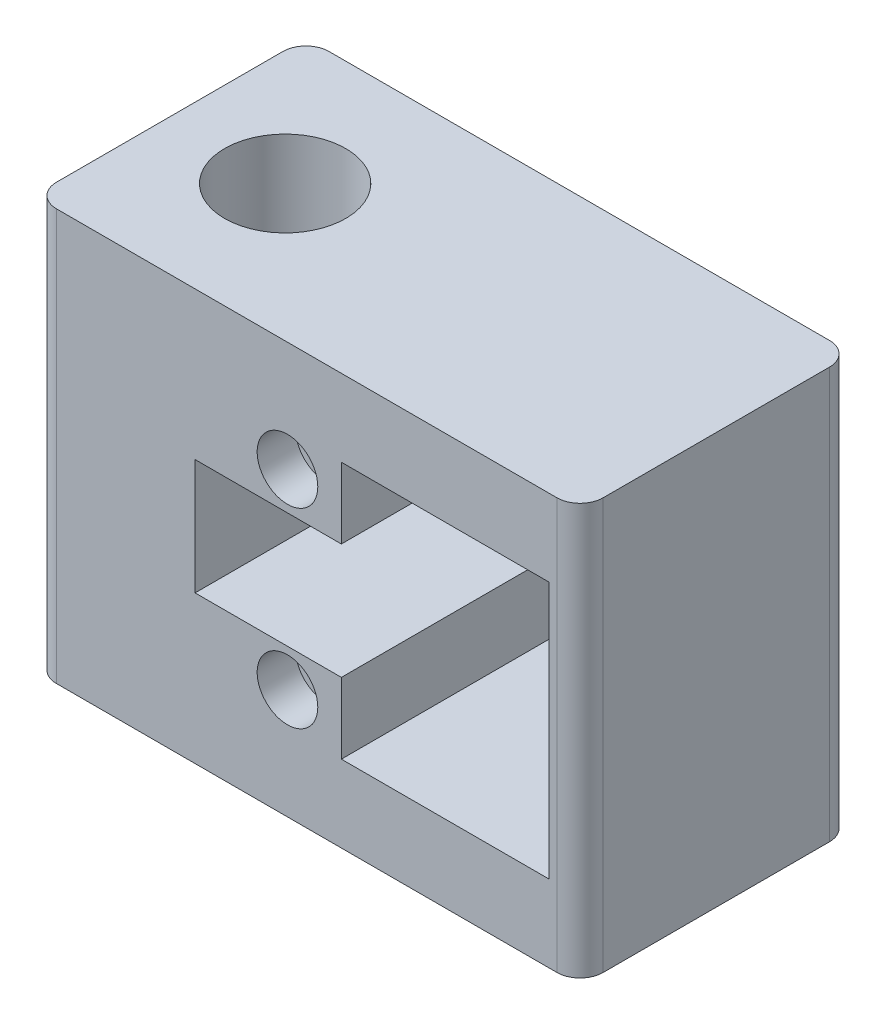
from build123d import *

# Parameters (mm, degrees)
SKETCH1_W           = 90.17
SKETCH1_H           = 67.818
BOSS_EXTRUDE1_DEPTH = 42.418
SKETCH2_W           = 90.17
SKETCH2_H           = 67.818
BOSS_EXTRUDE2_DEPTH = 2.54
SKETCH3_R           = 4.064
CUT_EXTRUDE1_DEPTH  = 95.758682177
SKETCH4_R           = 5
CUT_EXTRUDE2_DEPTH  = 6.35
SKETCH5_R           = 9.9949
CUT_EXTRUDE3_DEPTH  = 15.24
FILLET1_R           = 3.81


with BuildPart() as part:
    # Sketch1 → Boss-Extrude1 (new body)
    with BuildSketch(Plane.XY):
        with Locations((-5.715, 21.209)):
            Rectangle(SKETCH1_W, SKETCH1_H)
        Polygon((0, 30.734), (0, 42.418), (34.29, 42.418), (34.29, 0), (0, 0), (0, 11.684), (-24.13, 11.684), (-24.13, 30.734), align=None, mode=Mode.SUBTRACT)
    extrude(amount=BOSS_EXTRUDE1_DEPTH)

    # Sketch2 → Boss-Extrude2 (add)
    with BuildSketch(Plane(origin=(0, 0, 0), x_dir=(-1, 0, 0), z_dir=(0, 0, -1))):
        with Locations((5.715, 21.209)):
            Rectangle(SKETCH2_W, SKETCH2_H)
    extrude(amount=BOSS_EXTRUDE2_DEPTH)

    # Sketch3 → Cut-Extrude1 (cut, through all)
    with BuildSketch(Plane.XZ.offset(12.7)):
        with Locations((-31.75, 19.939)):
            Circle(SKETCH3_R)
    extrude(amount=-CUT_EXTRUDE1_DEPTH, mode=Mode.SUBTRACT)

    # Sketch4 → Cut-Extrude2 (cut)
    with BuildSketch(Plane.XY.offset(42.418)):
        with Locations((-8.89, 36.961)):
            Circle(SKETCH4_R)
        with Locations((-8.89, 5.461)):
            Circle(SKETCH4_R)
    extrude(amount=-CUT_EXTRUDE2_DEPTH, mode=Mode.SUBTRACT)

    # Sketch5 → Cut-Extrude3 (cut)
    with BuildSketch(Plane(origin=(0, 55.118, 0), x_dir=(1, 0, 0), z_dir=(0, 1, 0))):
        with Locations((-31.75, -19.939)):
            Circle(SKETCH5_R)
    extrude(amount=-CUT_EXTRUDE3_DEPTH, mode=Mode.SUBTRACT)

    # Fillet1
    fillet1_edges = [part.edges().sort_by_distance(p)[0] for p in [
        (-50.8, 21.209, -2.54),
        (-50.8, 21.209, 42.418),
        (39.37, 21.209, -2.54),
        (39.37, 21.209, 42.418),
    ]]
    fillet(fillet1_edges, radius=FILLET1_R)


solid = part.part
